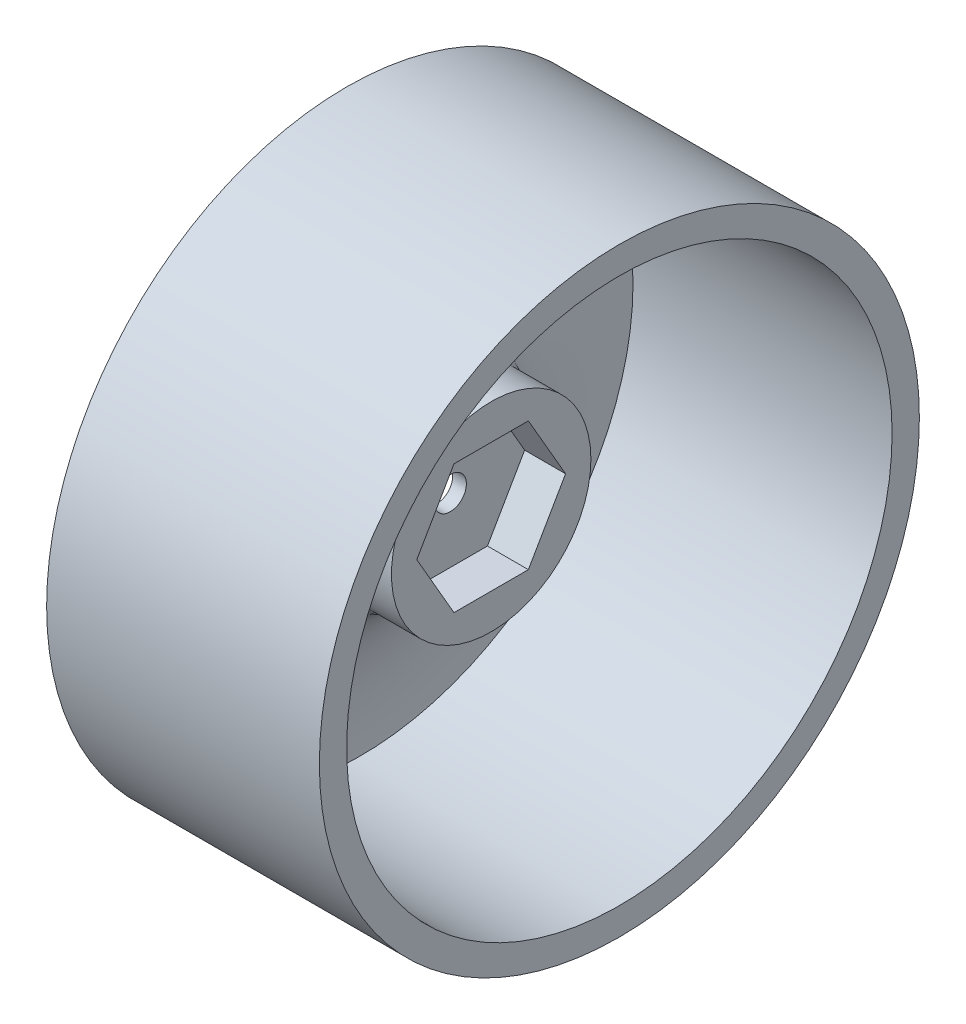
from build123d import *

# Parameters (mm, degrees)
CUT_EXTRUDE1_DEPTH = 3.81
SKETCH6_R          = 1.5
CUT_EXTRUDE2_DEPTH = 44.022081819


with BuildPart() as part:
    # Sketch2 → Main Revolve (revolve)
    with BuildSketch(Plane(origin=(0, 0, 0), x_dir=(1, 0, 0), z_dir=(0, 1, 0))):
        with BuildLine():
            Line((0.762, 8.018670644), (0.762, 9.288670644))
            Line((0.762, 9.288670644), (-3.81, 9.288670644))
            add(Edge.make_bspline(
                [(-11.43, 25.4), (-11.63985212, 16.185984948), (-9.577624941, 10.541628275), (-3.81, 9.288670644)],
                knots=[0, 0, 0, 0, 1, 1, 1, 1], degree=3))
            Line((-11.43, 25.4), (12.7, 25.4))
            Line((12.7, 25.4), (12.7, 27.94))
            Line((12.7, 27.94), (-12.7, 27.94))
            Line((-12.7, 27.94), (-12.7, 25.4))
            add(Edge.make_bspline(
                [(-4.318, 8.128), (-12.85906141, 7.336688862), (-12.7, 25.4)],
                knots=[0, 0, 0, 1, 1, 1], degree=2))
            Line((-4.318, 8.128), (-4.318, 0))
            Line((-4.318, 0), (0.762, 0))
            Line((0.762, 0), (0.762, 8.018670644))
        make_face()
    revolve(axis=Axis((0.762, 0, 0), (-1, 0, 0)))

    # Sketch5 → Cut-Extrude1 (cut)
    with BuildSketch(Plane(origin=(0.762, 0, 0), x_dir=(0, 0, -1), z_dir=(1, 0, 0))):
        Polygon((6.92820323, 0), (3.464101615, 6), (-3.464101615, 6), (-6.92820323, 0), (-3.464101615, -6), (3.464101615, -6), align=None)
    extrude(amount=-CUT_EXTRUDE1_DEPTH, mode=Mode.SUBTRACT)

    # Sketch6 → Cut-Extrude2 (cut, through all)
    with BuildSketch(Plane.ZY.offset(4.318)):
        Circle(SKETCH6_R)
    extrude(amount=-CUT_EXTRUDE2_DEPTH, mode=Mode.SUBTRACT)


solid = part.part
